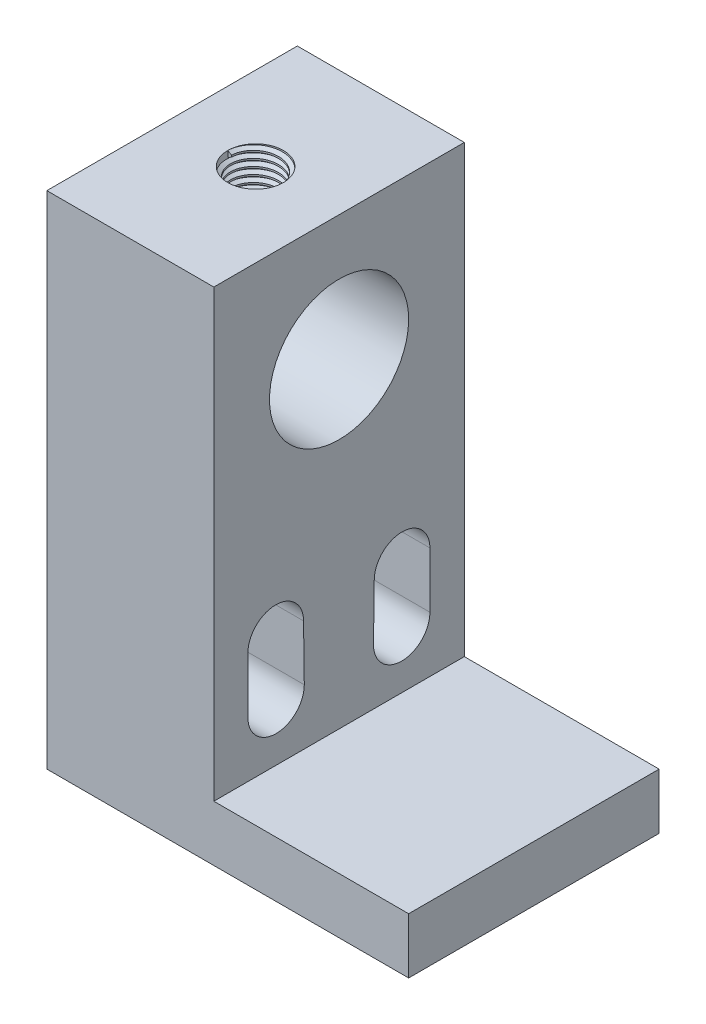
from build123d import *
from build123d.topology import SkipClean

# Parameters (mm, degrees)
BOSS_EXTRU_1_DEPTH      = 45
ESQUISSE2_R             = 12.5
ENL_V_MAT_EXTRU_1_DEPTH = 45
ENL_V_MAT_EXTRU_2_DEPTH = 45
ESQUISSE4_R             = 5
ENL_V_MAT_EXTRU_3_DEPTH = 25
FILETAGE1_PITCH         = 1.25


with BuildPart() as part:
    # Esquisse1 → Boss.-Extru.1 (new body)
    with BuildSketch(Plane.XY):
        Polygon((0, 0), (30, 0), (30, -80), (65, -80), (65, -90), (0, -90), align=None)
    extrude(amount=BOSS_EXTRU_1_DEPTH)

    # Esquisse2 → Enlèv. mat.-Extru.1 (cut)
    with BuildSketch(Plane(origin=(30, 0, 0), x_dir=(0, 0, -1), z_dir=(1, 0, 0))):
        with Locations((-22.5, -22.5)):
            Circle(ESQUISSE2_R)
    extrude(amount=-ENL_V_MAT_EXTRU_1_DEPTH, mode=Mode.SUBTRACT)

    # Esquisse3 → Enlèv. mat.-Extru.2 (cut)
    with BuildSketch(Plane(origin=(30, 0, 0), x_dir=(0, 0, -1), z_dir=(1, 0, 0))):
        with BuildLine():
            Line((-38.885405835, -70), (-38.885405835, -60))
            ThreePointArc((-38.885405835, -60), (-33.885405835, -55), (-28.885405835, -60))
            Line((-28.885405835, -60), (-28.75, -70))
            ThreePointArc((-28.75, -70), (-33.817702918, -75.067702918), (-38.885405835, -70))
        make_face()
        with BuildLine():
            Line((-6.182297082, -70), (-6.182297082, -60))
            ThreePointArc((-6.182297082, -60), (-11.182297082, -55), (-16.182297082, -60))
            Line((-16.182297082, -60), (-16.317702918, -70))
            ThreePointArc((-16.317702918, -70), (-11.25, -75.067702918), (-6.182297082, -70))
        make_face()
    extrude(amount=-ENL_V_MAT_EXTRU_2_DEPTH, mode=Mode.SUBTRACT)

    # Esquisse4 → Enlèv. mat.-Extru.3 (cut)
    with BuildSketch(Plane(origin=(0, 0, 0), x_dir=(1, 0, 0), z_dir=(0, 1, 0))):
        with Locations(Location((15, -22.5, 0), (0, 0, 270))):
            Circle(ESQUISSE4_R)
    extrude(amount=-ENL_V_MAT_EXTRU_3_DEPTH, mode=Mode.SUBTRACT)

    # Filetage1: the profile of Profil de filetage1 profile screwed along a right-hand helix of 8 turns, 8 arcs to a turn; built about Z, then put on its axis
    with SkipClean():  # the faces are left unmerged after this step: merging them gives an invalid solid
        filetage1_z = Axis((0, 0, 0), (0, 0, 1))
        filetage1_corners = [(5.0003, 0, -0.000173205), (5.0003, 0, 1.093923202), (4.323417656, 0, 0.703124998), (4.323417656, 0, 0.390624998)]
        with BuildLine(mode=Mode.PRIVATE) as filetage1_profile:
            Line(filetage1_corners[0], filetage1_corners[1])
            Line(filetage1_corners[1], filetage1_corners[2])
            Line(filetage1_corners[2], filetage1_corners[3])
            Line(filetage1_corners[3], filetage1_corners[0])
        filetage1_cap = Face(filetage1_profile.wire())
        filetage1_turn_angles = [0, 22.5, 45, 67.5, 90, 112.5, 135, 157.5, 180, 202.5, 225, 247.5, 270, 292.5, 315, 337.5, 360]
        filetage1_turn_weights = [1, 0.9238795325112867, 1, 0.9238795325112867, 1, 0.9238795325112867, 1, 0.9238795325112867, 1, 0.9238795325112867, 1, 0.9238795325112867, 1, 0.9238795325112867, 1, 0.9238795325112867, 1]
        filetage1_turn_rails = [Edge.make_bspline([Vector(p[0], p[1], 0).rotate(filetage1_z, filetage1_turn_angles[k]) / filetage1_turn_weights[k] + Vector(0, 0, p[2] + FILETAGE1_PITCH * filetage1_turn_angles[k] / 360) for k in range(17)], [0, 0, 0, 1, 1, 2, 2, 3, 3, 4, 4, 5, 5, 6, 6, 7, 7, 8, 8, 8], 2, filetage1_turn_weights) for p in filetage1_corners]
        filetage1_turn_sides = [Face.make_surface_from_curves(filetage1_turn_rails[p[0]], filetage1_turn_rails[p[1]]) for p in [(0, 1), (1, 2), (2, 3), (3, 0)]]
        filetage1 = Plane(origin=(15, 0, 22.5), x_dir=(-1, 0, 0), z_dir=(0, -1, 0)) * Solid(Shell([*[p.moved(Location((0, 0, FILETAGE1_PITCH * i))) for i in range(8) for p in filetage1_turn_sides], filetage1_cap, filetage1_cap.rotate(filetage1_z, 2880).moved(Location((0, 0, FILETAGE1_PITCH * 2880 / 360)))]))
        add(filetage1)


solid = part.part
